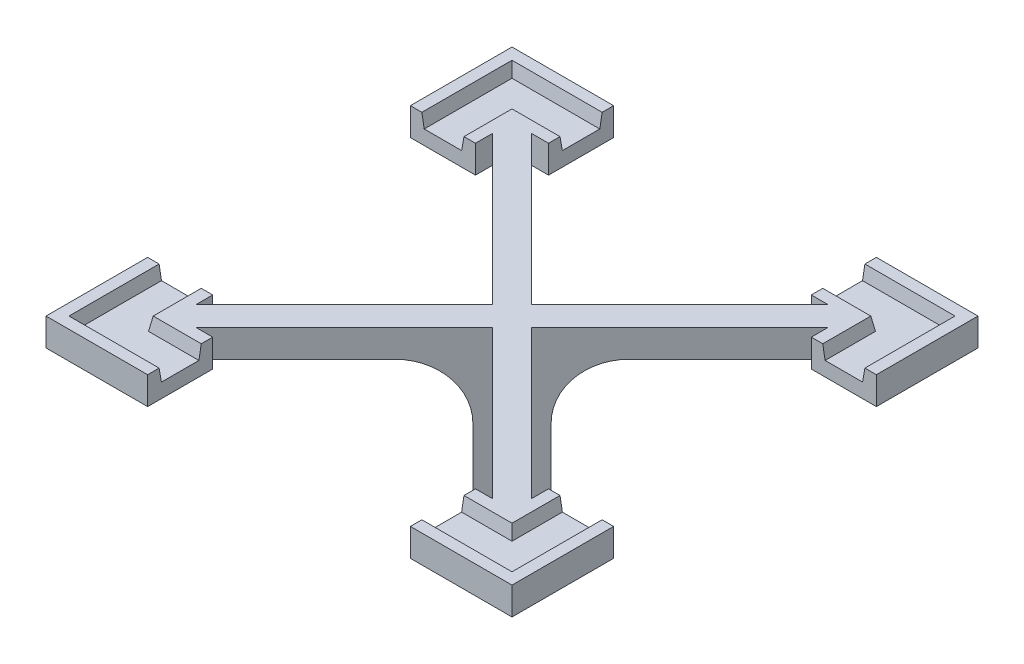
from build123d import *

# Parameters (mm, degrees)
SKETCH5_R                = 154.617689271
BOSS_EXTRUDE4_DEPTH      = 3.175
BOSS_EXTRUDE9_DEPTH      = 95.25
CUT_EXTRUDE1_START       = -95.25
CUT_EXTRUDE1_DEPTH       = 82.55
BOSS_EXTRUDE10_DEPTH     = 12.7
CUT_EXTRUDE11_DEPTH      = 6.096
CUT_EXTRUDE11_DRAFT      = -10
FILLET2_R                = 25.4
CIRPATTERN7_COUNT        = 4
CIRPATTERN7_COPY_1_DEPTH = 6.096
CIRPATTERN7_COPY_1_DRAFT = -10
CIRPATTERN7_COPY_2_DEPTH = 6.096
CIRPATTERN7_COPY_2_DRAFT = -10
CIRPATTERN7_COPY_3_DEPTH = 6.096
CIRPATTERN7_COPY_3_DRAFT = -10
FILLET2_OF_CIRPATTERN7_R = 25.4
SKETCH26_R               = 154.617689271
CUT_EXTRUDE9_DEPTH       = 6.35
SKETCH27_R               = 2.249999945
CUT_EXTRUDE12_DEPTH      = 35.000000104
CIRPATTERN8_COUNT        = 4


# Read off the part's stored shape, not the designer's step: Cut-Extrude11
with BuildPart() as part:
    # Sketch5 → Boss-Extrude4 (new, symmetric)
    with BuildSketch(Plane(origin=(0, 0, 0), x_dir=(1, 0, 0), z_dir=(0, 1, 0))):
        with Locations(Location((0, 0, 0), (0, 0, 270))):
            Circle(SKETCH5_R)
    extrude(amount=BOSS_EXTRUDE4_DEPTH, both=True)

    # Sketch15 → Boss-Extrude9 (add)
    with BuildSketch(Plane(origin=(0, 3.175, 0), x_dir=(1, 0, 0), z_dir=(0, 1, 0))):
        Polygon((0, 8.980256121), (94.292689271, 103.272945392), (103.272945392, 94.292689271), (8.980256121, 0), (0, 0), align=None)
    boss_extrude9 = extrude(amount=BOSS_EXTRUDE9_DEPTH)

    # Sketch17 → Cut-Extrude1 (cut)
    with BuildSketch(Plane(origin=(0, 98.425, 0), x_dir=(1, 0, 0), z_dir=(0, 1, 0)).offset(CUT_EXTRUDE1_START)):
        Polygon((13.470384182, 4.490128061), (119.126854284, 110.146598163), (110.146598163, 119.126854284), (4.490128061, 13.470384182), align=None)
    cut_extrude1 = extrude(amount=CUT_EXTRUDE1_DEPTH, mode=Mode.SUBTRACT)

    # Sketch19 → Boss-Extrude10 (add)
    with BuildSketch(Plane(origin=(0, 98.425, 0), x_dir=(1, 0, 0), z_dir=(0, 1, 0))):
        Polygon((60.325, 106.992689271), (81.592689271, 106.992689271), (106.992689271, 106.992689271), (106.992689271, 81.592689271), (106.992689271, 60.325), (77.102561211, 60.325), (77.102561211, 77.102561211), (60.325, 77.102561211), align=None)
    boss_extrude10 = extrude(amount=-BOSS_EXTRUDE10_DEPTH)


with BuildPart() as cut_extrude11_tool:
    # Cut-Extrude11 outline → Cut-Extrude11 (with draft: the straight prism first)
    with BuildSketch(Plane(origin=(0, 92.329, 0), x_dir=(1, 0, 0), z_dir=(0, 1, 0))):
        Polygon((83.452561211, 60.325), (100.642689271, 60.325), (100.642689271, 100.642689271), (60.325, 100.642689271), (60.325, 83.452561211), (83.452561211, 83.452561211), align=None)
    extrude(amount=CUT_EXTRUDE11_DEPTH)
    # Cut-Extrude11: the draft: its side faces are tilted about the plane it starts from
    cut_extrude11_sides = [cut_extrude11_tool.faces().sort_by_distance(p)[0] for p in [
        (92.047625241, 95.377, -60.325),
        (100.642689271, 95.377, -80.483844636),
        (80.483844635, 95.377, -100.642689271),
        (60.325, 95.377, -92.047625241),
        (71.888780606, 95.377, -83.452561211),
        (83.452561211, 95.377, -71.888780606),
    ]]
    draft(cut_extrude11_sides, Plane(origin=(0, 92.329, 0), x_dir=(1, 0, 0), z_dir=(0, 1, 0)), CUT_EXTRUDE11_DRAFT)


with BuildPart() as part_1:
    add(part.part)

    # Cut-Extrude11: cut by cut_extrude11_tool
    add(cut_extrude11_tool.part, mode=Mode.SUBTRACT)

    # Fillet2
    fillet2_edges = [part_1.edges().sort_by_distance(p)[0] for p in [
        (8.980256121, 85.725, -8.980256121),
    ]]
    fillet(fillet2_edges, radius=FILLET2_R)

    # CirPattern7: Boss-Extrude9, Cut-Extrude1, Boss-Extrude10 ×4 about axis
    cirpattern7_axis = Axis((0, 0, 0), (0, 1, 0))
    add([boss_extrude9.rotate(cirpattern7_axis, i * 360 / CIRPATTERN7_COUNT) for i in range(1, CIRPATTERN7_COUNT)])
    add([cut_extrude1.rotate(cirpattern7_axis, i * 360 / CIRPATTERN7_COUNT) for i in range(1, CIRPATTERN7_COUNT)], mode=Mode.SUBTRACT)
    add([boss_extrude10.rotate(cirpattern7_axis, i * 360 / CIRPATTERN7_COUNT) for i in range(1, CIRPATTERN7_COUNT)])


with BuildPart() as cirpattern7_copy_1_tool:
    # CirPattern7 copy 1 sketch → CirPattern7 copy 1 (with draft: the straight prism first)
    with BuildSketch(Plane(origin=(0, 92.329, 0), x_dir=(0, 0, -1), z_dir=(0, 1, 0))):
        Polygon((83.452561211, 60.325), (100.642689271, 60.325), (100.642689271, 100.642689271), (60.325, 100.642689271), (60.325, 83.452561211), (83.452561211, 83.452561211), align=None)
    extrude(amount=CIRPATTERN7_COPY_1_DEPTH)
    # CirPattern7 copy 1: the draft: its side faces are tilted about the plane it starts from
    cirpattern7_copy_1_sides = [cirpattern7_copy_1_tool.faces().sort_by_distance(p)[0] for p in [
        (-60.325, 95.377, -92.047625241),
        (-80.483844636, 95.377, -100.642689271),
        (-100.642689271, 95.377, -80.483844635),
        (-92.047625241, 95.377, -60.325),
        (-83.452561211, 95.377, -71.888780606),
        (-71.888780606, 95.377, -83.452561211),
    ]]
    draft(cirpattern7_copy_1_sides, Plane(origin=(0, 92.329, 0), x_dir=(0, 0, -1), z_dir=(0, 1, 0)), CIRPATTERN7_COPY_1_DRAFT)


with BuildPart() as part_2:
    add(part_1.part)

    # CirPattern7 copy 1: cut by cirpattern7_copy_1_tool
    add(cirpattern7_copy_1_tool.part, mode=Mode.SUBTRACT)


with BuildPart() as cirpattern7_copy_2_tool:
    # CirPattern7 copy 2 sketch → CirPattern7 copy 2 (with draft: the straight prism first)
    with BuildSketch(Plane(origin=(0, 92.329, 0), x_dir=(-1, 0, 0), z_dir=(0, 1, 0))):
        Polygon((83.452561211, 60.325), (100.642689271, 60.325), (100.642689271, 100.642689271), (60.325, 100.642689271), (60.325, 83.452561211), (83.452561211, 83.452561211), align=None)
    extrude(amount=CIRPATTERN7_COPY_2_DEPTH)
    # CirPattern7 copy 2: the draft: its side faces are tilted about the plane it starts from
    cirpattern7_copy_2_sides = [cirpattern7_copy_2_tool.faces().sort_by_distance(p)[0] for p in [
        (-92.047625241, 95.377, 60.325),
        (-100.642689271, 95.377, 80.483844636),
        (-80.483844635, 95.377, 100.642689271),
        (-60.325, 95.377, 92.047625241),
        (-71.888780606, 95.377, 83.452561211),
        (-83.452561211, 95.377, 71.888780606),
    ]]
    draft(cirpattern7_copy_2_sides, Plane(origin=(0, 92.329, 0), x_dir=(-1, 0, 0), z_dir=(0, 1, 0)), CIRPATTERN7_COPY_2_DRAFT)


with BuildPart() as part_3:
    add(part_2.part)

    # CirPattern7 copy 2: cut by cirpattern7_copy_2_tool
    add(cirpattern7_copy_2_tool.part, mode=Mode.SUBTRACT)


with BuildPart() as cirpattern7_copy_3_tool:
    # CirPattern7 copy 3 sketch → CirPattern7 copy 3 (with draft: the straight prism first)
    with BuildSketch(Plane.ZX.offset(92.329)):
        Polygon((83.452561211, 60.325), (100.642689271, 60.325), (100.642689271, 100.642689271), (60.325, 100.642689271), (60.325, 83.452561211), (83.452561211, 83.452561211), align=None)
    extrude(amount=CIRPATTERN7_COPY_3_DEPTH)
    # CirPattern7 copy 3: the draft: its side faces are tilted about the plane it starts from
    cirpattern7_copy_3_sides = [cirpattern7_copy_3_tool.faces().sort_by_distance(p)[0] for p in [
        (60.325, 95.377, 92.047625241),
        (80.483844636, 95.377, 100.642689271),
        (100.642689271, 95.377, 80.483844635),
        (92.047625241, 95.377, 60.325),
        (83.452561211, 95.377, 71.888780606),
        (71.888780606, 95.377, 83.452561211),
    ]]
    draft(cirpattern7_copy_3_sides, Plane.ZX.offset(92.329), CIRPATTERN7_COPY_3_DRAFT)


with BuildPart() as part_4:
    add(part_3.part)

    # CirPattern7 copy 3: cut by cirpattern7_copy_3_tool
    add(cirpattern7_copy_3_tool.part, mode=Mode.SUBTRACT)

    # Fillet2 of CirPattern7
    fillet2_of_cirpattern7_edges = [part_4.edges().sort_by_distance(p)[0] for p in [
        (-8.980256121, 85.725, -8.980256121),
        (-8.980256121, 85.725, 8.980256121),
        (8.980256121, 85.725, 8.980256121),
    ]]
    fillet(fillet2_of_cirpattern7_edges, radius=FILLET2_OF_CIRPATTERN7_R)

    # Sketch26 → Cut-Extrude9 (cut)
    with BuildSketch(Plane(origin=(0, 3.175, 0), x_dir=(1, 0, 0), z_dir=(0, 1, 0))):
        Circle(SKETCH26_R)
    extrude(amount=-CUT_EXTRUDE9_DEPTH, mode=Mode.SUBTRACT)

    # Sketch27 → Cut-Extrude12 (cut)
    with BuildSketch(Plane.XZ.offset(-3.175)):
        with Locations(Location((5.388153673, 5.388153673, 0), (0, 0, 270))):
            Circle(SKETCH27_R)
    cut_extrude12 = extrude(amount=-CUT_EXTRUDE12_DEPTH, mode=Mode.SUBTRACT)

    # CirPattern8: Cut-Extrude12 ×4 about axis
    cirpattern8_axis = Axis((0, 0, 0), (0, 1, 0))
    for i in range(1, CIRPATTERN8_COUNT):
        add(cut_extrude12.rotate(cirpattern8_axis, i * 360 / CIRPATTERN8_COUNT), mode=Mode.SUBTRACT)


solid = part_4.part
